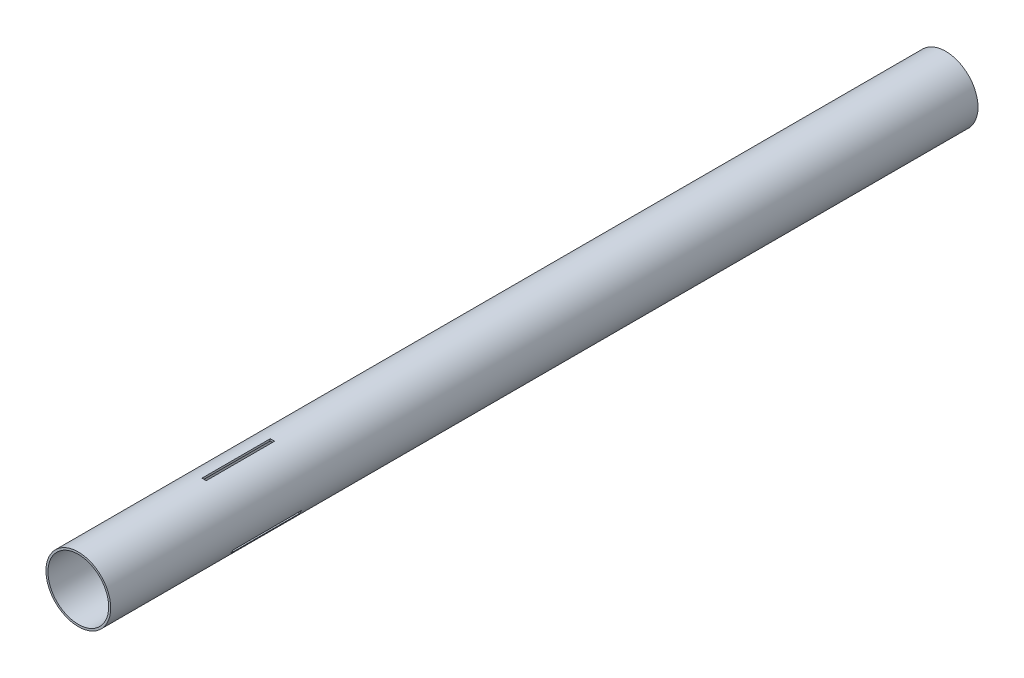
from build123d import *

# Parameters (mm, degrees)
SKETCH1_R           = 23.6982
SKETCH1_R_2         = 22.225
BOSS_EXTRUDE1_DEPTH = 635
CUT_EXTRUDE1_REACH  = 649.37
SKETCH2_W           = 3.175
SKETCH2_H           = 50.038
CIRPATTERN2_COUNT   = 3


with BuildPart() as part:
    # Sketch1 → Boss-Extrude1 (new body)
    with BuildSketch(Plane.XY):
        Circle(SKETCH1_R)
        Circle(SKETCH1_R_2, mode=Mode.SUBTRACT)
    extrude(amount=BOSS_EXTRUDE1_DEPTH)

    # Sketch2 → Cut-Extrude1 (cut, up to next)
    with BuildSketch(Plane(origin=(0, 100, 0), x_dir=(1, 0, 0), z_dir=(0, 1, 0)), mode=Mode.PRIVATE) as cut_extrude1_sk1:
        with Locations((0, -517.906)):
            Rectangle(SKETCH2_W, SKETCH2_H)
    cut_extrude1_tool1 = extrude(cut_extrude1_sk1.sketch, amount=-CUT_EXTRUDE1_REACH, mode=Mode.PRIVATE) & part.part
    cut_extrude1 = cut_extrude1_tool1.solids().sort_by_distance((0, 100, 517.906))[0]
    add(cut_extrude1, mode=Mode.SUBTRACT)

    # CirPattern2: Cut-Extrude1 ×3 about axis
    cirpattern2_axis = Axis((0, 0, 635), (0, 0, 1))
    for i in range(1, CIRPATTERN2_COUNT):
        add(cut_extrude1.rotate(cirpattern2_axis, i * 360 / CIRPATTERN2_COUNT), mode=Mode.SUBTRACT)


solid = part.part
